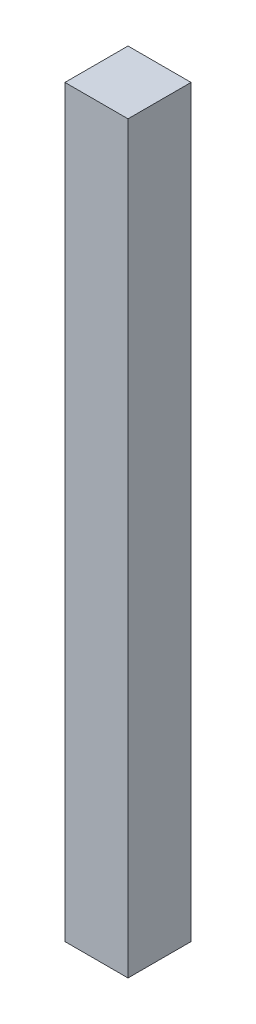
from build123d import *

# Parameters (mm, degrees)
SKETCH1_W           = 25.4
SKETCH1_H           = 25.4
BOSS_EXTRUDE1_DEPTH = 299.72


with BuildPart() as part:
    # Sketch1 → Boss-Extrude1 (new body)
    with BuildSketch(Plane(origin=(0, 0, 0), x_dir=(1, 0, 0), z_dir=(0, 1, 0))):
        with Locations((12.7, 12.7)):
            Rectangle(SKETCH1_W, SKETCH1_H)
    extrude(amount=BOSS_EXTRUDE1_DEPTH)


solid = part.part
